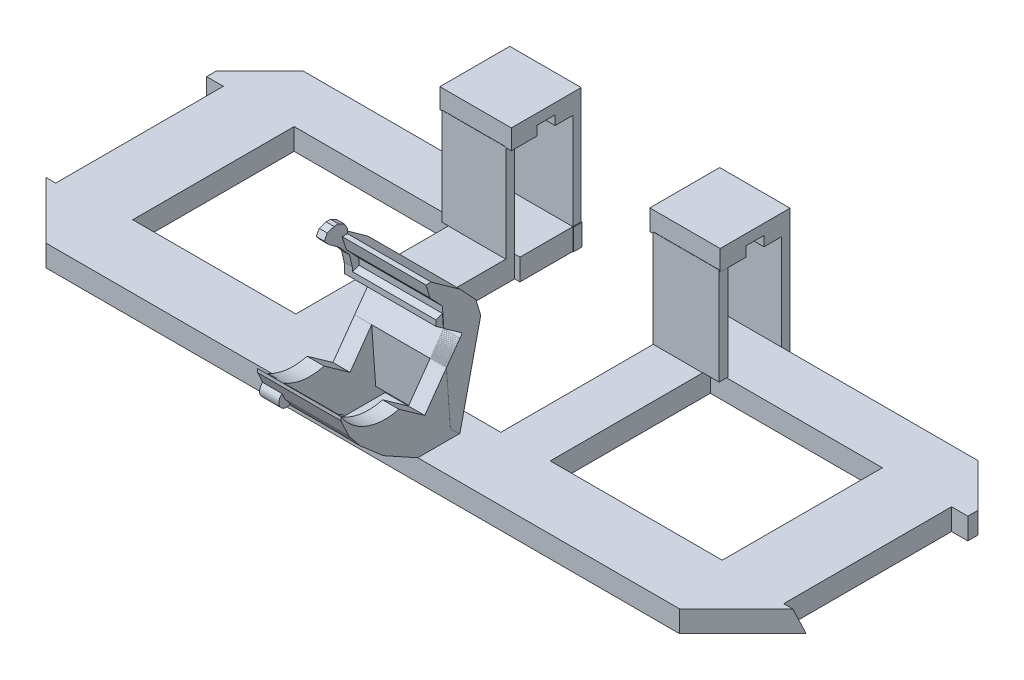
from build123d import *

# Parameters (mm, degrees)
SKETCH1_W                 = 179.83765079
SKETCH1_H                 = 65.58922254
BOSS_EXTRUDE1_DEPTH       = 5.08
CHAMFER1_SIZE             = 15.08
CHAMFER2_SIZE             = 15.08
CHAMFER3_SIZE             = 10.16
CHAMFER4_SIZE             = 10.16
SKETCH3_W                 = 3.81
SKETCH3_H                 = 38.099680287
CUT_EXTRUDE1_DEPTH        = 6.35
SKETCH4_W                 = 3.81
SKETCH4_H                 = 38.099706196
CUT_EXTRUDE2_DEPTH        = 6.35
SKETCH5_W                 = 4.392146866
SKETCH5_H                 = 38.056267817
CUT_EXTRUDE3_DEPTH        = 6.35
SKETCH6_W                 = 6.19054223
SKETCH6_H                 = 38.026729387
CUT_EXTRUDE4_DEPTH        = 6.35
SKETCH8_W                 = 27.338359173
SKETCH8_H                 = 51.428797761
CUT_EXTRUDE5_DEPTH        = 6.35
SKETCH9_W                 = 2.546211571
SKETCH9_H                 = 9.341281337
CUT_EXTRUDE6_DEPTH        = 6.35
SKETCH10_W                = 3.376883936
SKETCH10_H                = 12.632678175
CUT_EXTRUDE7_DEPTH        = 6.35
SKETCH12_W                = 2.756639948
SKETCH12_H                = 12.734119477
CUT_EXTRUDE8_DEPTH        = 6.35
SKETCH13_W                = 16.841406914
SKETCH13_H                = 1.987959833
BOSS_EXTRUDE2_DEPTH       = 22.767607554
SKETCH14_W                = 15.124040429
SKETCH14_H                = 2.0910969
BOSS_EXTRUDE3_DEPTH       = 22.947970607
SKETCH15_W                = 16.618154609
SKETCH15_H                = 1.983427617
BOSS_EXTRUDE4_DEPTH       = 22.629557376
SKETCH16_W                = 15.571433136
SKETCH16_H                = 2.092780508
BOSS_EXTRUDE5_DEPTH       = 22.993258255
SKETCH22_W                = 16.618154609
SKETCH22_H                = 4.834792933
BOSS_EXTRUDE15_DEPTH      = 16.51
SKETCH25_W                = 16.87703482
SKETCH25_H                = 4.696742755
BOSS_EXTRUDE16_DEPTH      = 16.51
SKETCH30_W                = 1.987959833
SKETCH30_H                = 5.08
BOSS_EXTRUDE22_DEPTH      = 17.018
SKETCH31_W                = 1.987959833
SKETCH31_H                = 5.08
BOSS_EXTRUDE23_DEPTH      = 16.764
SKETCH33_W                = 21.685261911
SKETCH33_H                = 28.119501849
BOSS_EXTRUDE24_DEPTH      = 23.120672488
SKETCH34_R                = 12.243366663
CUT_EXTRUDE9_DEPTH        = 22.098
CUT_EXTRUDE10_DEPTH       = 22.098
BOSS_EXTRUDE25_DEPTH      = 21.59
CUT_EXTRUDE11_DEPTH       = 21.59
BOSS_EXTRUDE26_DEPTH      = 21.59
SKETCH39_W                = 20.150260906
SKETCH39_H                = 8.256649514
CUT_EXTRUDE12_DEPTH       = 12.192
SKETCH40_R                = 1.854870842
BOSS_EXTRUDE28_DEPTH      = 6.604
CUT_EXTRUDE13_DEPTH       = 2.040709507
SKETCH42_W                = 38.556128879
SKETCH42_H                = 38.144978895
CUT_EXTRUDE14_DEPTH       = 5.117761092
SKETCH43_W                = 40.636127549
SKETCH43_H                = 37.829026633
CUT_EXTRUDE15_DEPTH       = 5.135910403
SKETCH44_W                = 13.805881743
SKETCH44_H                = 20.612610851
CUT_EXTRUDE16_DEPTH       = 23.876
CUT_EXTRUDE17_DEPTH       = 7.62
CUT_EXTRUDE18_DEPTH       = 6.858
BOSS_EXTRUDE36_DEPTH      = 0.0254
BOSS_EXTRUDE36_DEPTH_BACK = 24.231261636
CUT_EXTRUDE23_DEPTH       = 73.914
SKETCH56_W                = 4.063313405
SKETCH56_H                = 35.09550159
CUT_EXTRUDE24_DEPTH       = 24.892
SKETCH57_W                = 4.280343193
SKETCH57_H                = 2.732470009
CUT_EXTRUDE26_DEPTH       = 74.168


with BuildPart() as part:
    # Sketch1 → Boss-Extrude1 (new body)
    with BuildSketch(Plane(origin=(0, 0, 0), x_dir=(1, 0, 0), z_dir=(0, 1, 0))):
        Rectangle(SKETCH1_W, SKETCH1_H)
    extrude(amount=BOSS_EXTRUDE1_DEPTH)

    # Chamfer1
    chamfer1_edges = [part.edges().sort_by_distance(p)[0] for p in [
        (-89.918825395, 2.54, 32.79461127),
    ]]
    chamfer(chamfer1_edges, length=CHAMFER1_SIZE)

    # Chamfer2
    chamfer2_edges = [part.edges().sort_by_distance(p)[0] for p in [
        (89.918825395, 2.54, 32.79461127),
    ]]
    chamfer(chamfer2_edges, length=CHAMFER2_SIZE)

    # Chamfer3
    chamfer3_edges = [part.edges().sort_by_distance(p)[0] for p in [
        (-89.918825395, 2.54, -32.79461127),
    ]]
    chamfer(chamfer3_edges, length=CHAMFER3_SIZE)

    # Chamfer4
    chamfer4_edges = [part.edges().sort_by_distance(p)[0] for p in [
        (89.918825395, 2.54, -32.79461127),
    ]]
    chamfer(chamfer4_edges, length=CHAMFER4_SIZE)

    # Sketch3 → Cut-Extrude1 (cut)
    with BuildSketch(Plane.XZ):
        with Locations((-15.332120697, -1.265836715)):
            Rectangle(SKETCH3_W, SKETCH3_H)
    extrude(amount=-CUT_EXTRUDE1_DEPTH, mode=Mode.SUBTRACT)

    # Sketch4 → Cut-Extrude2 (cut)
    with BuildSketch(Plane(origin=(0, 0, 0), x_dir=(-1, 0, 0), z_dir=(0, -1, 0))):
        with Locations((-15.702370547, 1.260178956)):
            Rectangle(SKETCH4_W, SKETCH4_H)
    extrude(amount=-CUT_EXTRUDE2_DEPTH, mode=Mode.SUBTRACT)

    # Sketch5 → Cut-Extrude3 (cut)
    with BuildSketch(Plane(origin=(0, 0, 0), x_dir=(-1, 0, 0), z_dir=(0, -1, 0))):
        with Locations((-88.271117119, 1.201493874)):
            Rectangle(SKETCH5_W, SKETCH5_H)
    extrude(amount=-CUT_EXTRUDE3_DEPTH, mode=Mode.SUBTRACT)

    # Sketch6 → Cut-Extrude4 (cut)
    with BuildSketch(Plane(origin=(0, 0, 0), x_dir=(-1, 0, 0), z_dir=(0, -1, 0))):
        with Locations((89.061740512, 1.235051786)):
            Rectangle(SKETCH6_W, SKETCH6_H)
    extrude(amount=-CUT_EXTRUDE4_DEPTH, mode=Mode.SUBTRACT)

    # Sketch8 → Cut-Extrude5 (cut)
    with BuildSketch(Plane(origin=(0, 0, 0), x_dir=(-1, 0, 0), z_dir=(0, -1, 0))):
        with Locations((-0.242058889, 7.930395452)):
            Rectangle(SKETCH8_W, SKETCH8_H)
    extrude(amount=-CUT_EXTRUDE5_DEPTH, mode=Mode.SUBTRACT)

    # Sketch9 → Cut-Extrude6 (cut)
    with BuildSketch(Plane(origin=(0, 0, 0), x_dir=(-1, 0, 0), z_dir=(0, -1, 0))):
        with Locations((14.700226483, 28.123970602)):
            Rectangle(SKETCH9_W, SKETCH9_H)
    extrude(amount=-CUT_EXTRUDE6_DEPTH, mode=Mode.SUBTRACT)

    # Sketch10 → Cut-Extrude7 (cut)
    with BuildSketch(Plane(origin=(0, 0, 0), x_dir=(-1, 0, 0), z_dir=(0, -1, 0))):
        with Locations((-15.060403874, 26.478272183)):
            Rectangle(SKETCH10_W, SKETCH10_H)
    extrude(amount=-CUT_EXTRUDE7_DEPTH, mode=Mode.SUBTRACT)

    # Sketch12 → Cut-Extrude8 (cut)
    with BuildSketch(Plane.XZ):
        with Locations((-14.595012294, -26.648365014)):
            Rectangle(SKETCH12_W, SKETCH12_H)
    extrude(amount=-CUT_EXTRUDE8_DEPTH, mode=Mode.SUBTRACT)

    # Sketch14 → Boss-Extrude3 (add)
    with BuildSketch(Plane(origin=(0, 5.08, 0), x_dir=(1, 0, 0), z_dir=(0, 1, 0))):
        with Locations((-24.799140912, 19.270128409)):
            Rectangle(SKETCH14_W, SKETCH14_H)
    extrude(amount=BOSS_EXTRUDE3_DEPTH)

    # Sketch16 → Boss-Extrude5 (add)
    with BuildSketch(Plane(origin=(0, 5.08, 0), x_dir=(1, 0, 0), z_dir=(0, 1, 0))):
        with Locations((25.393087115, 19.2636418)):
            Rectangle(SKETCH16_W, SKETCH16_H)
    extrude(amount=BOSS_EXTRUDE5_DEPTH)



with BuildPart() as body_2:
    # Sketch13 → Boss-Extrude2 (new body)
    with BuildSketch(Plane(origin=(0, 5.08, 0), x_dir=(1, 0, 0), z_dir=(0, 1, 0))):
        with Locations((-24.394035725, 33.788591186)):
            Rectangle(SKETCH13_W, SKETCH13_H)
    extrude(amount=BOSS_EXTRUDE2_DEPTH)

    # Sketch25 → Boss-Extrude16 (add)
    with BuildSketch(Plane(origin=(0, 0, -34.782571103), x_dir=(-1, 0, 0), z_dir=(0, 0, -1))):
        with Locations((24.411849678, 30.195978932)):
            Rectangle(SKETCH25_W, SKETCH25_H)
    extrude(amount=-BOSS_EXTRUDE16_DEPTH)


with BuildPart() as body_3:
    # Sketch15 → Boss-Extrude4 (new body)
    with BuildSketch(Plane(origin=(0, 5.08, 0), x_dir=(1, 0, 0), z_dir=(0, 1, 0))):
        with Locations((25.057923147, 33.786325078)):
            Rectangle(SKETCH15_W, SKETCH15_H)
    extrude(amount=BOSS_EXTRUDE4_DEPTH)

    # Sketch22 → Boss-Extrude15 (add)
    with BuildSketch(Plane(origin=(0, 0, -34.778038887), x_dir=(-1, 0, 0), z_dir=(0, 0, -1))):
        with Locations((-25.057923147, 30.126953843)):
            Rectangle(SKETCH22_W, SKETCH22_H)
    extrude(amount=-BOSS_EXTRUDE15_DEPTH)


with BuildPart() as part_1:
    add(part.part)

    add(body_2.part)  # Boss-Extrude22 merges body 2
    # Sketch30 → Boss-Extrude22 (add)
    with BuildSketch(Plane.ZY.offset(32.814739182)):
        with Locations((-33.788591186, 2.54)):
            Rectangle(SKETCH30_W, SKETCH30_H)
    extrude(amount=-BOSS_EXTRUDE22_DEPTH)


    add(body_3.part)  # Boss-Extrude23 merges body 3
    # Sketch31 → Boss-Extrude23 (add)
    with BuildSketch(Plane(origin=(33.367000451, 0, 0), x_dir=(0, 0, -1), z_dir=(1, 0, 0))):
        with Locations((33.788591186, 2.54)):
            Rectangle(SKETCH31_W, SKETCH31_H)
    extrude(amount=-BOSS_EXTRUDE23_DEPTH)

    # Sketch33 → Boss-Extrude24 (add)
    with BuildSketch(Plane(origin=(0, 5.08, 0), x_dir=(1, 0, 0), z_dir=(0, 1, 0))):
        with Locations((2.159201378, -36.914669055)):
            Rectangle(SKETCH33_W, SKETCH33_H)
    extrude(amount=BOSS_EXTRUDE24_DEPTH)

    # Sketch34 → Cut-Extrude9 (cut)
    with BuildSketch(Plane.ZY.offset(8.683429578)):
        with Locations((40.563196746, 29.044819163)):
            Circle(SKETCH34_R)
    extrude(amount=-CUT_EXTRUDE9_DEPTH, mode=Mode.SUBTRACT)

    # Sketch35 → Cut-Extrude10 (cut)
    with BuildSketch(Plane.ZY.offset(8.683429578)):
        Polygon((50.97441998, 21.747892037), (49.109447959, 17.691345784), (46.445447435, 14.361345129), (40.935809988, 9.578253279), (32.79461127, 5.08), (35.91151583, 2.586476352), (52.560539547, 3.833238176), (53.408176077, 21.747892037), align=None)
    extrude(amount=-CUT_EXTRUDE10_DEPTH, mode=Mode.SUBTRACT)

    # Sketch36 → Boss-Extrude25 (add)
    with BuildSketch(Plane.ZY.offset(8.683429578)):
        Polygon((22.854918131, 28.200672488), (23.758644104, 32.094986161), (26.055013578, 37.580757681), (28.734111297, 40.642583646), (32.051089426, 43.066529202), (33.70957849, 43.066529202), (35.094690236, 41.854556424), (35.094690236, 40.642583646), (34.029456795, 39.425174), (31.505518676, 37.580757681), (29.142025315, 34.879622412), (28.495814373, 32.094986161), (28.348965553, 28.200672488), align=None)
    extrude(amount=-BOSS_EXTRUDE25_DEPTH)

    # Sketch37 → Cut-Extrude11 (cut)
    with BuildSketch(Plane.ZY.offset(8.683429578)):
        Polygon((38.429893519, 42.343588038), (35.094690236, 40.642583646), (30.473140813, 38.285523162), (27.047243981, 35.977251048), (24.917326644, 33.488100498), (23.35529919, 30.356902204), (22.817948256, 29.27974295), (25.483085937, 40.642583646), (29.68084007, 45.548333664), align=None)
    extrude(amount=-CUT_EXTRUDE11_DEPTH, mode=Mode.SUBTRACT)

    # Sketch38 → Boss-Extrude26 (add)
    with BuildSketch(Plane.ZY.offset(8.683429578)):
        Polygon((34.029456795, 39.425174), (35.094690236, 40.642583646), (34.414620997, 41.976012984), (32.783915524, 42.505160559), (31.737751532, 42.505160559), (30.348852548, 41.796800956), (29.643159131, 40.540633851), (29.643159131, 39.464053404), (27.047243981, 35.977251048), align=None)
    extrude(amount=-BOSS_EXTRUDE26_DEPTH)

    # Sketch39 → Cut-Extrude12 (cut)
    with BuildSketch(Plane(origin=(0, 48.080623616, 15.60168025), x_dir=(1, 0, 0), z_dir=(0, 0.9511765709451412, 0.3086472596428536))):
        with Locations((3.29538341, -16.708700293)):
            Rectangle(SKETCH39_W, SKETCH39_H)
    extrude(amount=-CUT_EXTRUDE12_DEPTH, mode=Mode.SUBTRACT)

    # Sketch40 → Boss-Extrude28 (add)
    with BuildSketch(Plane.ZY.offset(8.683429578)):
        with Locations((48.675308141, 17.672058428)):
            Circle(SKETCH40_R)
    extrude(amount=-BOSS_EXTRUDE28_DEPTH)

    # Sketch41 → Cut-Extrude13 (cut)
    with BuildSketch(Plane.ZY.offset(8.683429578)):
        Polygon((46.774343534, 14.499373457), (47.051470138, 15.330753268), (46.912906836, 16.360080653), (46.319064114, 18.953193874), (50.555142199, 23.209066716), (51.881390945, 22.140149816), (51.010421619, 15.607879872), align=None)
    extrude(amount=-CUT_EXTRUDE13_DEPTH, mode=Mode.SUBTRACT)

    # Sketch42 → Cut-Extrude14 (cut)
    with BuildSketch(Plane(origin=(0, 0, 0), x_dir=(-1, 0, 0), z_dir=(0, -1, 0))):
        with Locations((50.094989428, 1.28848602)):
            Rectangle(SKETCH42_W, SKETCH42_H)
    extrude(amount=-CUT_EXTRUDE14_DEPTH, mode=Mode.SUBTRACT)

    # Sketch43 → Cut-Extrude15 (cut)
    with BuildSketch(Plane(origin=(0, 0, 0), x_dir=(-1, 0, 0), z_dir=(0, -1, 0))):
        with Locations((-49.606993621, 1.112463592)):
            Rectangle(SKETCH43_W, SKETCH43_H)
    extrude(amount=-CUT_EXTRUDE15_DEPTH, mode=Mode.SUBTRACT)

    # Sketch44 → Cut-Extrude16 (cut)
    with BuildSketch(Plane(origin=(0, 0, 22.854918131), x_dir=(-1, 0, 0), z_dir=(0, 0, -1))):
        with Locations((-2.253629649, 14.934419241)):
            Rectangle(SKETCH44_W, SKETCH44_H)
    extrude(amount=-CUT_EXTRUDE16_DEPTH, mode=Mode.SUBTRACT)

    # Sketch45 → Cut-Extrude17 (cut)
    with BuildSketch(Plane.ZY.offset(85.966469397)):
        Polygon((17.778312908, 5.08), (19.376185936, 5.08), (17.778312908, 0), align=None)
    extrude(amount=CUT_EXTRUDE17_DEPTH, mode=Mode.SUBTRACT)

    # Sketch46 → Cut-Extrude18 (cut)
    with BuildSketch(Plane(origin=(86.075043686, 0, 0), x_dir=(0, 0, -1), z_dir=(1, 0, 0))):
        Polygon((-19.432527787, 5.08), (-17.826640035, 0), (-17.826640035, 5.08), align=None)
    extrude(amount=CUT_EXTRUDE18_DEPTH, mode=Mode.SUBTRACT)


with BuildPart() as body_2_2:
    # Sketch50 → Boss-Extrude36 (new, two sides: drawn at the far end of the back side and taken through both)
    with BuildSketch(Plane.ZY.offset(11.223429578).offset(-BOSS_EXTRUDE36_DEPTH_BACK)):
        Polygon((22.854918131, 5.08), (17.934028423, 26.765392345), (19.065727332, 30.549566424), (22.854918131, 34.603310456), (29.643159131, 39.464053404), (30.871492711, 39.464053404), (29.944729045, 36.365141658), (26.991865354, 33.206115311), (25.092653659, 7.015143452), align=None)
    extrude(amount=BOSS_EXTRUDE36_DEPTH + BOSS_EXTRUDE36_DEPTH_BACK)


with BuildPart() as cut_extrude23_tool:
    # Sketch55 → Cut-Extrude23 (new body)
    with BuildSketch(Plane.ZY.offset(11.248829578)):
        Polygon((22.283622332, 25.365976513), (31.163450804, 12.916916131), (38.113263691, 17.842729652), (29.252178323, 30.305074568), align=None)
    extrude(amount=-CUT_EXTRUDE23_DEPTH)


with BuildPart() as part_2:
    add(part_1.part)

    # Cut-Extrude23: cut by cut_extrude23_tool
    add(cut_extrude23_tool.part, mode=Mode.SUBTRACT)

    # Sketch57 → Cut-Extrude26 (cut)
    with BuildSketch(Plane.ZY.offset(32.850367088)):
        with Locations((-26.476871949, 28.678304309)):
            Rectangle(SKETCH57_W, SKETCH57_H)
    extrude(amount=-CUT_EXTRUDE26_DEPTH, mode=Mode.SUBTRACT)


with BuildPart() as body_2_2_1:
    add(body_2_2.part)

    # Cut-Extrude23: cut by cut_extrude23_tool
    add(cut_extrude23_tool.part, mode=Mode.SUBTRACT)

    # Sketch56 → Cut-Extrude24 (cut)
    with BuildSketch(Plane.XY.offset(32.79461127)):
        with Locations((-10.71508628, 22.627750795)):
            Rectangle(SKETCH56_W, SKETCH56_H)
    extrude(amount=-CUT_EXTRUDE24_DEPTH, mode=Mode.SUBTRACT)


solid = Compound([part_2.part, body_2_2_1.part])
